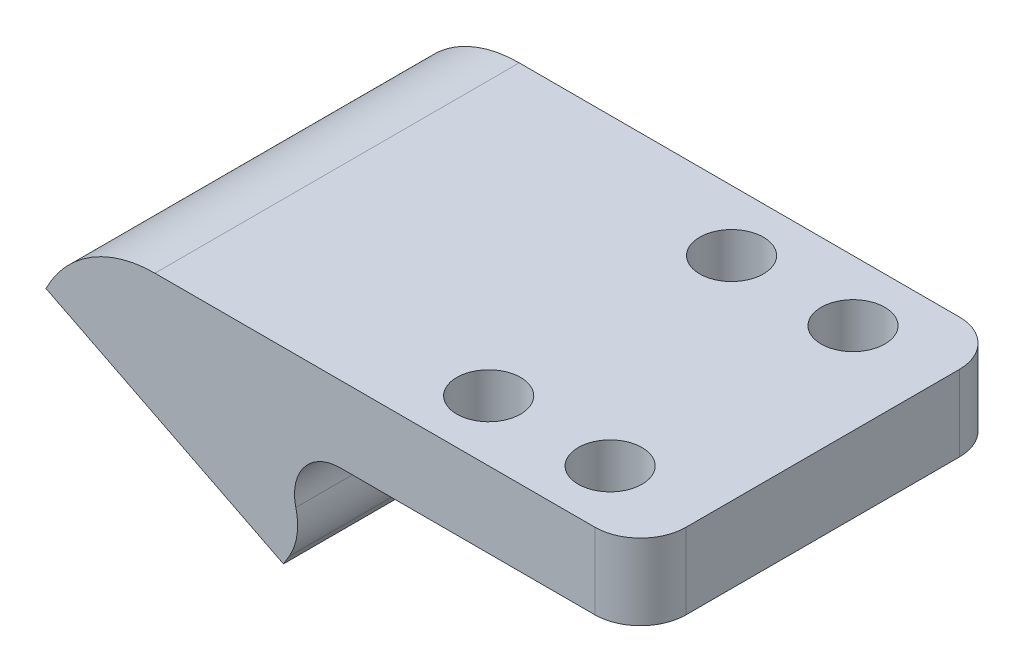
from build123d import *

# Parameters (mm, degrees)
ESQUISSE1_W             = 17
ESQUISSE1_H             = 5
BOSS_EXTRU_1_DEPTH      = 24
BOSS_EXTRU_2_DEPTH      = 24
CONG_1_R                = 4
CONG_2_R                = 8
CONG_3_R                = 3
ESQUISSE3_W             = 24
ESQUISSE3_H             = 5
BOSS_EXTRU_3_DEPTH      = 10
ESQUISSE4_R             = 2.1
ENL_V_MAT_EXTRU_1_DEPTH = 10
CONG_4_R                = 3


with BuildPart() as part:
    # Esquisse1 → Boss.-Extru.1 (new body)
    with BuildSketch(Plane.XY):
        with Locations((1.940369129, 2.5)):
            Rectangle(ESQUISSE1_W, ESQUISSE1_H)
    extrude(amount=BOSS_EXTRU_1_DEPTH)

    # Esquisse2 → Boss.-Extru.2 (add)
    with BuildSketch(Plane.XY.offset(24)):
        Polygon((-6.559630871, 0), (-6.559630871, 5), (-16.471058056, 5), (-18.723069156, 0.535871193), (-3.080508445, -7.355303518), (-0.501566554, -3.056100904), align=None)
    extrude(amount=-BOSS_EXTRU_2_DEPTH)

    # Congé1
    cong_1_edges = [part.edges().sort_by_distance(p)[0] for p in [
        (-0.501566554, -3.056100904, 12),
    ]]
    fillet(cong_1_edges, radius=CONG_1_R)

    # Congé2
    cong_2_edges = [part.edges().sort_by_distance(p)[0] for p in [
        (-16.471058056, 5, 12),
    ]]
    fillet(cong_2_edges, radius=CONG_2_R)

    # Congé3
    cong_3_edges = [part.edges().sort_by_distance(p)[0] for p in [
        (-6.559630871, 0, 12),
    ]]
    fillet(cong_3_edges, radius=CONG_3_R)

    # Esquisse3 → Boss.-Extru.3 (add)
    with BuildSketch(Plane(origin=(10.440369129, 0, 0), x_dir=(0, 0, -1), z_dir=(1, 0, 0))):
        with Locations((-12, 2.5)):
            Rectangle(ESQUISSE3_W, ESQUISSE3_H)
    extrude(amount=BOSS_EXTRU_3_DEPTH)

    # Esquisse4 → Enlèv. mat.-Extru.1 (cut)
    with BuildSketch(Plane(origin=(0, 5, 0), x_dir=(1, 0, 0), z_dir=(0, 1, 0))):
        with Locations((6.440369129, -4)):
            Circle(ESQUISSE4_R)
        with Locations((14.440369129, -4)):
            Circle(ESQUISSE4_R)
        with Locations((6.440369129, -20)):
            Circle(ESQUISSE4_R)
        with Locations((14.440369129, -20)):
            Circle(ESQUISSE4_R)
    extrude(amount=-ENL_V_MAT_EXTRU_1_DEPTH, mode=Mode.SUBTRACT)

    # Congé4
    cong_4_edges = [part.edges().sort_by_distance(p)[0] for p in [
        (20.440369129, 2.5, 0),
        (20.440369129, 2.5, 24),
    ]]
    fillet(cong_4_edges, radius=CONG_4_R)


solid = part.part
